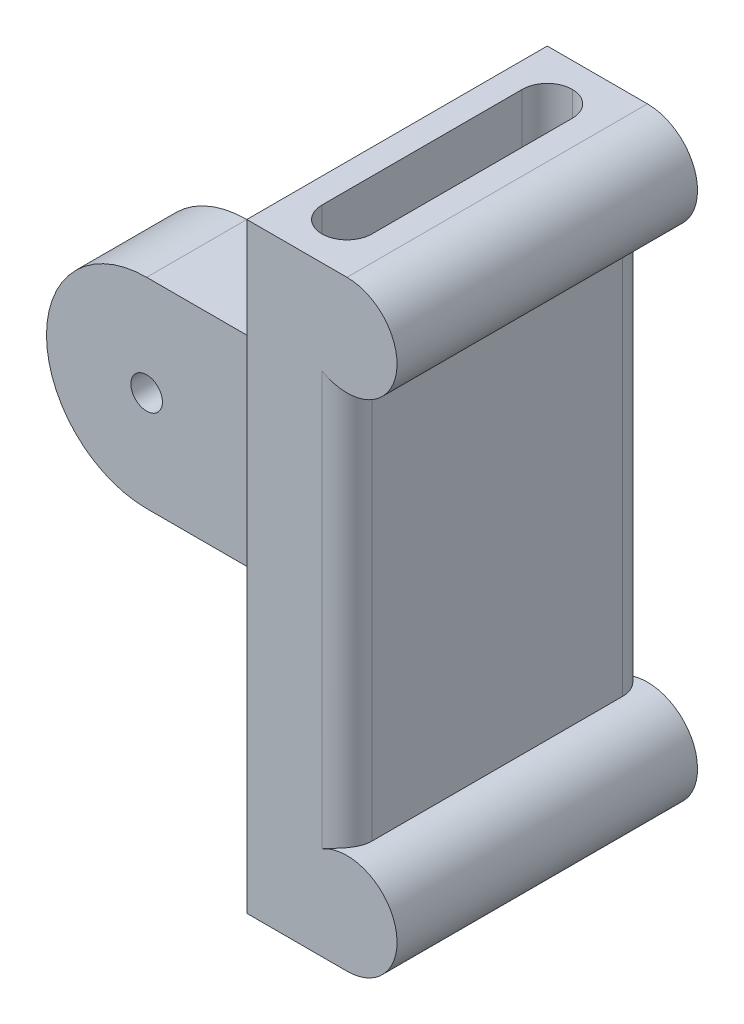
from build123d import *

# Parameters (mm, degrees)
SKETCH1_R           = 12.7
SKETCH1_R_2         = 2
BOSS_EXTRUDE1_DEPTH = 12.7
SKETCH2_W           = 38.1
SKETCH2_H           = 76.2
BOSS_EXTRUDE2_DEPTH = 12.7
FILLET1_R           = 12.7
SKETCH3_W           = 6.35
SKETCH3_H           = 31.75
CUT_EXTRUDE1_DEPTH  = 89.9
BOSS_EXTRUDE3_DEPTH = 38.1
FILLET2_R           = 3.175


with BuildPart() as part:
    # Sketch1 → Boss-Extrude1 (new body)
    # profile 1 of 2: a face of its own
    with BuildSketch(Plane.XY):
        Circle(SKETCH1_R)
        Circle(SKETCH1_R_2, mode=Mode.SUBTRACT)
    # profile 2 of 2: a face of its own
    with BuildSketch(Plane.XY):
        with BuildLine():
            ThreePointArc((12.7, 0), (8.980256121, -8.980256121), (0, -12.7))
            Line((0, -12.7), (25.4, -12.7))
            Line((25.4, -12.7), (25.4, 12.7))
            Line((25.4, 12.7), (0, 12.7))
            ThreePointArc((0, 12.7), (8.980256121, 8.980256121), (12.7, 0))
        make_face()
    extrude(amount=BOSS_EXTRUDE1_DEPTH)

    # Sketch2 → Boss-Extrude2 (add)
    with BuildSketch(Plane(origin=(25.4, 0, 0), x_dir=(0, 0, -1), z_dir=(1, 0, 0))):
        with Locations((-6.35, 0)):
            Rectangle(SKETCH2_W, SKETCH2_H)
    extrude(amount=BOSS_EXTRUDE2_DEPTH)

    # Fillet1
    fillet1_edges = [part.edges().sort_by_distance(p)[0] for p in [
        (25.4, 12.7, 6.35),
        (25.4, -12.7, 6.35),
        (25.4, 0, 12.7),
        (25.4, 0, 0),
    ]]
    fillet(fillet1_edges, radius=FILLET1_R - 0.0001)  # a hair under: the kernel refuses the full size

    # Sketch3 → Cut-Extrude1 (cut, through all)
    with BuildSketch(Plane(origin=(0, 38.1, 0), x_dir=(1, 0, 0), z_dir=(0, 1, 0))):
        with Locations((31.75, -6.35)):
            Rectangle(SKETCH3_W, SKETCH3_H)
    extrude(amount=-CUT_EXTRUDE1_DEPTH, mode=Mode.SUBTRACT)

    # Sketch4 → Boss-Extrude3 (add)
    with BuildSketch(Plane.XY.offset(25.4)):
        with BuildLine():
            Line((38.1, 38.1), (38.1, 25.4))
            ThreePointArc((38.1, 25.4), (44.45, 31.75), (38.1, 38.1))
        make_face()
        with BuildLine():
            Line((38.1, -25.4), (38.1, -38.1))
            ThreePointArc((38.1, -38.1), (44.45, -31.75), (38.1, -25.4))
        make_face()
    extrude(amount=-BOSS_EXTRUDE3_DEPTH)

    # Fillet2
    fillet2_edges = [part.edges().sort_by_distance(p)[0] for p in [
        (34.925, 0, 22.225),
        (28.575, 0, 22.225),
        (34.925, 0, -9.525),
        (28.575, 0, -9.525),
        (38.1, 0, 25.4),
        (38.1, 0, -12.7),
    ]]
    fillet(fillet2_edges, radius=FILLET2_R - 0.0001)  # a hair under: the kernel refuses the full size


solid = part.part
